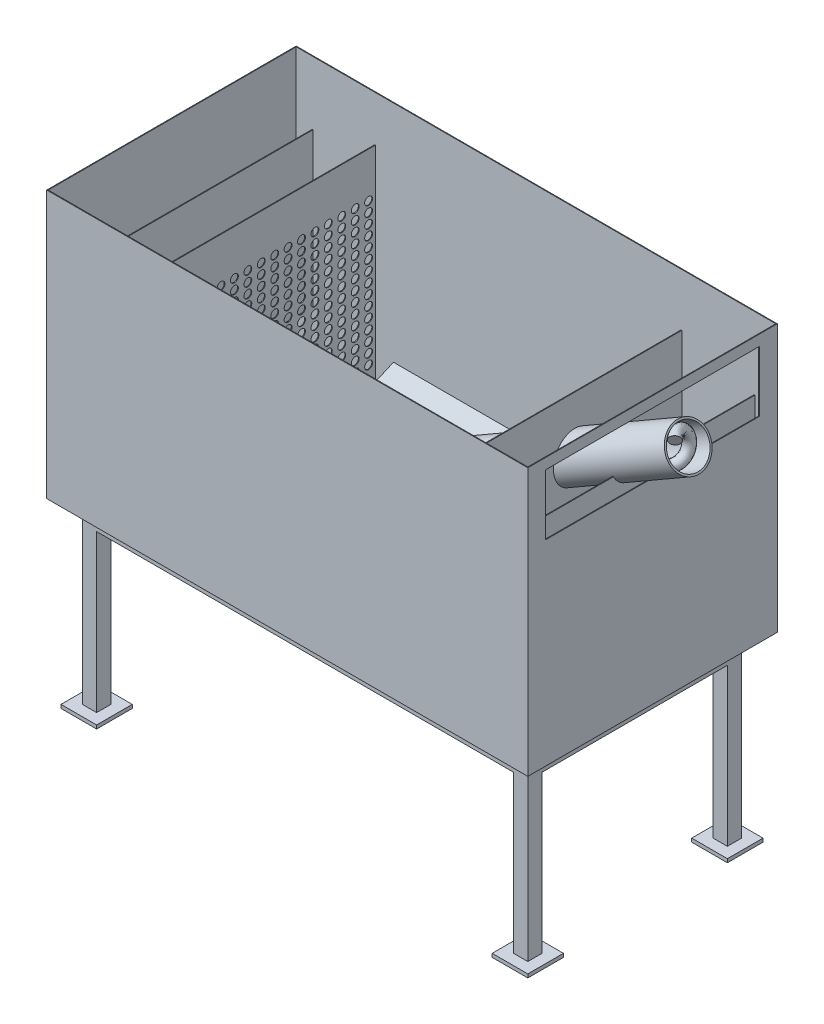
from build123d import *

# Parameters (mm, degrees)
MASTER_FOOTPRINT_W                       = 1350
MASTER_FOOTPRINT_H                       = 700
BATH_BASE_PLATE_DEPTH                    = 750
BATH_SHELL_2MM_T                         = -2
SKETCH_1_R                               = 50.00000000000001
INLET_D100_OPENING_DEPTH                 = 10
INLET_IMPACT_BAFFLE_START                = 125
SKETCH_2_W                               = 540
SKETCH_2_H                               = 430
INLET_IMPACT_BAFFLE_DEPTH                = 2
DISTRIBUTOR_D22_START                    = 250
SKETCH_3_W                               = 639.9999999999999
SKETCH_3_H                               = 648
SKETCH_3_R                               = 11.000000000000004
SKETCH_3_R_2                             = 10.999999999999996
SKETCH_3_R_3                             = 11.00000000000001
DISTRIBUTOR_D22_DEPTH                    = 2
OUTLET_SUBMERGED_BAFFLE_START            = 1130.0000000000002
SKETCH_4_W                               = 599.9999999999999
SKETCH_4_H                               = 330
OUTLET_SUBMERGED_BAFFLE_DEPTH            = 2
OVERFLOW_WEIR_Z550_START                 = 1290
SKETCH_5_W                               = 690
SKETCH_5_H                               = 548
OVERFLOW_WEIR_Z550_DEPTH                 = 2
OUTLET_WEIR_SLOT_W600_START              = 1345.0000000000002
SKETCH_6_W                               = 599.9999999999999
SKETCH_6_H                               = 170
OUTLET_WEIR_SLOT_W600_DEPTH              = 10
SLOPED_SEDIMENT_FLOOR_START              = 275
SLOPED_SEDIMENT_FLOOR_DEPTH              = 825.0000000000001
SKETCH_8_W                               = 39.99999999999999
SKETCH_8_H                               = 39.99999999999999
SKETCH_8_H_2                             = 40
SKETCH_8_W_2                             = 40
FRAME_LEGS_40X40_H500_DEPTH              = 500
FRAME_LONGITUDINAL_RAILS_START           = -20
SKETCH_9_W                               = 1250
SKETCH_9_H                               = 39.99999999999999
SKETCH_9_H_2                             = 39.999999999999886
FRAME_LONGITUDINAL_RAILS_DEPTH           = 40
FRAME_TRANSVERSE_RAILS_START             = -20
SKETCH_10_W                              = 39.99999999999999
SKETCH_10_H                              = 520
SKETCH_10_W_2                            = 40
FRAME_TRANSVERSE_RAILS_DEPTH             = 40
FRAME_FOOT_PADS_100X100_START            = -500
SKETCH_11_W                              = 100.00000000000001
SKETCH_11_H                              = 100.00000000000001
SKETCH_11_H_2                            = 99.99999999999989
SKETCH_11_W_2                            = 100
FRAME_FOOT_PADS_100X100_DEPTH            = 10
SCREW_PASSAGE_D120_PROFILE_R             = 60
SCREW_CASING_ID110_T5_START              = 381.410161514
SCREW_CASING_ID110_T5_OUTLINE_R          = 60
SCREW_CASING_ID110_T5_OUTLINE_R_2        = 55
SCREW_CASING_ID110_T5_DEPTH              = 1212.435565298
SHAFTLESS_ROUND_COIL_D100_P100_PROFILE_R = 15


# Read off the part's stored shape, not the designer's step: SCREW_CASING_ID110_T5
with BuildPart() as part:
    # MASTER_FOOTPRINT → BATH_BASE_PLATE (new body)
    with BuildSketch(Plane(origin=(0, 0, 0), x_dir=(1, 0, 0), z_dir=(0, 1, 0))):
        with Locations((675, 350)):
            Rectangle(MASTER_FOOTPRINT_W, MASTER_FOOTPRINT_H)
    extrude(amount=BATH_BASE_PLATE_DEPTH)

    # BATH_SHELL_2MM
    bath_shell_2mm_openings = [part.faces().sort_by_distance(p)[0] for p in [
        (675, 750, -350),
    ]]
    offset(amount=BATH_SHELL_2MM_T, openings=bath_shell_2mm_openings, kind=Kind.INTERSECTION)

    # Эскиз1 → INLET_D100_OPENING (cut)
    with BuildSketch(Plane(origin=(0, 0, 0), x_dir=(0, 0, -1), z_dir=(1, 0, 0))):
        with Locations((350, 420)):
            Circle(SKETCH_1_R)
    extrude(amount=INLET_D100_OPENING_DEPTH, mode=Mode.SUBTRACT)

    # Эскиз6 → OUTLET_WEIR_SLOT_W600 (cut)
    with BuildSketch(Plane(origin=(0, 0, 0), x_dir=(0, 0, -1), z_dir=(1, 0, 0)).offset(OUTLET_WEIR_SLOT_W600_START)):
        with Locations((349.99999999999994, 635)):
            Rectangle(SKETCH_6_W, SKETCH_6_H)
    extrude(amount=OUTLET_WEIR_SLOT_W600_DEPTH, mode=Mode.SUBTRACT)

    # Эскиз7 → SLOPED_SEDIMENT_FLOOR (add)
    with BuildSketch(Plane(origin=(0, 0, 0), x_dir=(0, 0, -1), z_dir=(1, 0, 0)).offset(SLOPED_SEDIMENT_FLOOR_START)):
        Polygon((2, -1), (2, 120), (279.99999999999994, -1), align=None)
        Polygon((698, -1), (698, 120), (420, -1), align=None)
    extrude(amount=SLOPED_SEDIMENT_FLOOR_DEPTH)

    # Эскиз8 → FRAME_LEGS_40X40_H500 (add)
    with BuildSketch(Plane(origin=(0, 0, 0), x_dir=(1, 0, 0), z_dir=(0, 1, 0))):
        with Locations((70, 70)):
            Rectangle(SKETCH_8_W, SKETCH_8_H)
        with Locations((70, 630)):
            Rectangle(SKETCH_8_W, SKETCH_8_H_2)
        with Locations((1280, 70)):
            Rectangle(SKETCH_8_W_2, SKETCH_8_H)
        with Locations((1280, 630)):
            Rectangle(SKETCH_8_W_2, SKETCH_8_H_2)
    extrude(amount=-FRAME_LEGS_40X40_H500_DEPTH)

    # Эскиз9 → FRAME_LONGITUDINAL_RAILS (add)
    with BuildSketch(Plane(origin=(0, 0, 0), x_dir=(1, 0, 0), z_dir=(0, 1, 0)).offset(FRAME_LONGITUDINAL_RAILS_START)):
        with Locations((675, 70)):
            Rectangle(SKETCH_9_W, SKETCH_9_H)
        with Locations((675, 630)):
            Rectangle(SKETCH_9_W, SKETCH_9_H_2)
    extrude(amount=-FRAME_LONGITUDINAL_RAILS_DEPTH)

    # Эскиз10 → FRAME_TRANSVERSE_RAILS (add)
    with BuildSketch(Plane(origin=(0, 0, 0), x_dir=(1, 0, 0), z_dir=(0, 1, 0)).offset(FRAME_TRANSVERSE_RAILS_START)):
        with Locations((70, 350)):
            Rectangle(SKETCH_10_W, SKETCH_10_H)
        with Locations((1280, 350)):
            Rectangle(SKETCH_10_W_2, SKETCH_10_H)
    extrude(amount=-FRAME_TRANSVERSE_RAILS_DEPTH)

    # Эскиз11 → FRAME_FOOT_PADS_100X100 (add)
    with BuildSketch(Plane(origin=(0, 0, 0), x_dir=(1, 0, 0), z_dir=(0, 1, 0)).offset(FRAME_FOOT_PADS_100X100_START)):
        with Locations((70, 70)):
            Rectangle(SKETCH_11_W, SKETCH_11_H)
        with Locations((70, 630)):
            Rectangle(SKETCH_11_W, SKETCH_11_H_2)
        with Locations((1280, 70)):
            Rectangle(SKETCH_11_W_2, SKETCH_11_H)
        with Locations((1280, 630)):
            Rectangle(SKETCH_11_W_2, SKETCH_11_H_2)
    extrude(amount=-FRAME_FOOT_PADS_100X100_DEPTH)


with BuildPart() as body_2:
    # Эскиз2 → INLET_IMPACT_BAFFLE (new body)
    with BuildSketch(Plane(origin=(0, 0, 0), x_dir=(0, 0, -1), z_dir=(1, 0, 0)).offset(INLET_IMPACT_BAFFLE_START)):
        with Locations((350, 435)):
            Rectangle(SKETCH_2_W, SKETCH_2_H)
    extrude(amount=INLET_IMPACT_BAFFLE_DEPTH)


with BuildPart() as body_3:
    # Эскиз3 → DISTRIBUTOR_D22 (new body)
    with BuildSketch(Plane(origin=(0, 0, 0), x_dir=(0, 0, -1), z_dir=(1, 0, 0)).offset(DISTRIBUTOR_D22_START)):
        with Locations((349.99999999999994, 326)):
            Rectangle(SKETCH_3_W, SKETCH_3_H)
        with Locations((48.8235294117647, 125)):
            Circle(SKETCH_3_R, mode=Mode.SUBTRACT)
        with Locations((48.8235294117647, 153.5)):
            Circle(SKETCH_3_R, mode=Mode.SUBTRACT)
        with Locations((48.8235294117647, 182)):
            Circle(SKETCH_3_R, mode=Mode.SUBTRACT)
        with Locations((48.8235294117647, 210.50000000000003)):
            Circle(SKETCH_3_R, mode=Mode.SUBTRACT)
        with Locations((48.8235294117647, 239)):
            Circle(SKETCH_3_R, mode=Mode.SUBTRACT)
        with Locations((48.8235294117647, 267.5)):
            Circle(SKETCH_3_R, mode=Mode.SUBTRACT)
        with Locations((48.8235294117647, 296.00000000000006)):
            Circle(SKETCH_3_R, mode=Mode.SUBTRACT)
        with Locations((48.8235294117647, 324.5)):
            Circle(SKETCH_3_R, mode=Mode.SUBTRACT)
        with Locations((48.8235294117647, 353)):
            Circle(SKETCH_3_R, mode=Mode.SUBTRACT)
        with Locations((48.8235294117647, 381.5)):
            Circle(SKETCH_3_R, mode=Mode.SUBTRACT)
        with Locations((48.8235294117647, 410.00000000000006)):
            Circle(SKETCH_3_R, mode=Mode.SUBTRACT)
        with Locations((48.8235294117647, 438.5)):
            Circle(SKETCH_3_R, mode=Mode.SUBTRACT)
        with Locations((48.8235294117647, 467)):
            Circle(SKETCH_3_R, mode=Mode.SUBTRACT)
        with Locations((48.8235294117647, 495.5)):
            Circle(SKETCH_3_R, mode=Mode.SUBTRACT)
        with Locations((48.8235294117647, 524)):
            Circle(SKETCH_3_R, mode=Mode.SUBTRACT)
        with Locations((86.4705882352941, 125)):
            Circle(SKETCH_3_R_2, mode=Mode.SUBTRACT)
        with Locations((86.4705882352941, 153.5)):
            Circle(SKETCH_3_R_2, mode=Mode.SUBTRACT)
        with Locations((86.4705882352941, 182)):
            Circle(SKETCH_3_R_2, mode=Mode.SUBTRACT)
        with Locations((86.4705882352941, 210.50000000000003)):
            Circle(SKETCH_3_R_2, mode=Mode.SUBTRACT)
        with Locations((86.4705882352941, 239)):
            Circle(SKETCH_3_R_2, mode=Mode.SUBTRACT)
        with Locations((86.4705882352941, 267.5)):
            Circle(SKETCH_3_R_2, mode=Mode.SUBTRACT)
        with Locations((86.4705882352941, 296.00000000000006)):
            Circle(SKETCH_3_R_2, mode=Mode.SUBTRACT)
        with Locations((86.4705882352941, 324.5)):
            Circle(SKETCH_3_R_2, mode=Mode.SUBTRACT)
        with Locations((86.4705882352941, 353)):
            Circle(SKETCH_3_R_2, mode=Mode.SUBTRACT)
        with Locations((86.4705882352941, 381.5)):
            Circle(SKETCH_3_R_2, mode=Mode.SUBTRACT)
        with Locations((86.4705882352941, 410.00000000000006)):
            Circle(SKETCH_3_R_2, mode=Mode.SUBTRACT)
        with Locations((86.4705882352941, 438.5)):
            Circle(SKETCH_3_R_2, mode=Mode.SUBTRACT)
        with Locations((86.4705882352941, 467)):
            Circle(SKETCH_3_R_2, mode=Mode.SUBTRACT)
        with Locations((86.4705882352941, 495.5)):
            Circle(SKETCH_3_R_2, mode=Mode.SUBTRACT)
        with Locations((86.4705882352941, 524)):
            Circle(SKETCH_3_R_2, mode=Mode.SUBTRACT)
        with Locations((124.11764705882351, 125)):
            Circle(SKETCH_3_R_2, mode=Mode.SUBTRACT)
        with Locations((124.11764705882351, 153.5)):
            Circle(SKETCH_3_R_2, mode=Mode.SUBTRACT)
        with Locations((124.11764705882351, 182)):
            Circle(SKETCH_3_R_2, mode=Mode.SUBTRACT)
        with Locations((124.11764705882351, 210.50000000000003)):
            Circle(SKETCH_3_R_2, mode=Mode.SUBTRACT)
        with Locations((124.11764705882351, 239)):
            Circle(SKETCH_3_R_2, mode=Mode.SUBTRACT)
        with Locations((124.11764705882351, 267.5)):
            Circle(SKETCH_3_R_2, mode=Mode.SUBTRACT)
        with Locations((124.11764705882351, 296.00000000000006)):
            Circle(SKETCH_3_R_2, mode=Mode.SUBTRACT)
        with Locations((124.11764705882351, 324.5)):
            Circle(SKETCH_3_R_2, mode=Mode.SUBTRACT)
        with Locations((124.11764705882351, 353)):
            Circle(SKETCH_3_R_2, mode=Mode.SUBTRACT)
        with Locations((124.11764705882351, 381.5)):
            Circle(SKETCH_3_R_2, mode=Mode.SUBTRACT)
        with Locations((124.11764705882351, 410.00000000000006)):
            Circle(SKETCH_3_R_2, mode=Mode.SUBTRACT)
        with Locations((124.11764705882351, 438.5)):
            Circle(SKETCH_3_R_2, mode=Mode.SUBTRACT)
        with Locations((124.11764705882351, 467)):
            Circle(SKETCH_3_R_2, mode=Mode.SUBTRACT)
        with Locations((124.11764705882351, 495.5)):
            Circle(SKETCH_3_R_2, mode=Mode.SUBTRACT)
        with Locations((124.11764705882351, 524)):
            Circle(SKETCH_3_R_2, mode=Mode.SUBTRACT)
        with Locations((161.76470588235293, 125)):
            Circle(SKETCH_3_R_3, mode=Mode.SUBTRACT)
        with Locations((161.76470588235293, 153.5)):
            Circle(SKETCH_3_R_3, mode=Mode.SUBTRACT)
        with Locations((161.76470588235293, 182)):
            Circle(SKETCH_3_R_3, mode=Mode.SUBTRACT)
        with Locations((161.76470588235293, 210.50000000000003)):
            Circle(SKETCH_3_R_3, mode=Mode.SUBTRACT)
        with Locations((161.76470588235293, 239)):
            Circle(SKETCH_3_R_3, mode=Mode.SUBTRACT)
        with Locations((161.76470588235293, 267.5)):
            Circle(SKETCH_3_R_3, mode=Mode.SUBTRACT)
        with Locations((161.76470588235293, 296.00000000000006)):
            Circle(SKETCH_3_R_3, mode=Mode.SUBTRACT)
        with Locations((161.76470588235293, 324.5)):
            Circle(SKETCH_3_R_3, mode=Mode.SUBTRACT)
        with Locations((161.76470588235293, 353)):
            Circle(SKETCH_3_R_3, mode=Mode.SUBTRACT)
        with Locations((161.76470588235293, 381.5)):
            Circle(SKETCH_3_R_3, mode=Mode.SUBTRACT)
        with Locations((161.76470588235293, 410.00000000000006)):
            Circle(SKETCH_3_R_3, mode=Mode.SUBTRACT)
        with Locations((161.76470588235293, 438.5)):
            Circle(SKETCH_3_R_3, mode=Mode.SUBTRACT)
        with Locations((161.76470588235293, 467)):
            Circle(SKETCH_3_R_3, mode=Mode.SUBTRACT)
        with Locations((161.76470588235293, 495.5)):
            Circle(SKETCH_3_R_3, mode=Mode.SUBTRACT)
        with Locations((161.76470588235293, 524)):
            Circle(SKETCH_3_R_3, mode=Mode.SUBTRACT)
        with Locations((199.41176470588232, 125)):
            Circle(SKETCH_3_R_3, mode=Mode.SUBTRACT)
        with Locations((199.41176470588232, 153.5)):
            Circle(SKETCH_3_R_3, mode=Mode.SUBTRACT)
        with Locations((199.41176470588232, 182)):
            Circle(SKETCH_3_R_3, mode=Mode.SUBTRACT)
        with Locations((199.41176470588232, 210.50000000000003)):
            Circle(SKETCH_3_R_3, mode=Mode.SUBTRACT)
        with Locations((199.41176470588232, 239)):
            Circle(SKETCH_3_R_3, mode=Mode.SUBTRACT)
        with Locations((199.41176470588232, 267.5)):
            Circle(SKETCH_3_R_3, mode=Mode.SUBTRACT)
        with Locations((199.41176470588232, 296.00000000000006)):
            Circle(SKETCH_3_R_3, mode=Mode.SUBTRACT)
        with Locations((199.41176470588232, 324.5)):
            Circle(SKETCH_3_R_3, mode=Mode.SUBTRACT)
        with Locations((199.41176470588232, 353)):
            Circle(SKETCH_3_R_3, mode=Mode.SUBTRACT)
        with Locations((199.41176470588232, 381.5)):
            Circle(SKETCH_3_R_3, mode=Mode.SUBTRACT)
        with Locations((199.41176470588232, 410.00000000000006)):
            Circle(SKETCH_3_R_3, mode=Mode.SUBTRACT)
        with Locations((199.41176470588232, 438.5)):
            Circle(SKETCH_3_R_3, mode=Mode.SUBTRACT)
        with Locations((199.41176470588232, 467)):
            Circle(SKETCH_3_R_3, mode=Mode.SUBTRACT)
        with Locations((199.41176470588232, 495.5)):
            Circle(SKETCH_3_R_3, mode=Mode.SUBTRACT)
        with Locations((199.41176470588232, 524)):
            Circle(SKETCH_3_R_3, mode=Mode.SUBTRACT)
        with Locations((237.05882352941174, 125)):
            Circle(SKETCH_3_R_3, mode=Mode.SUBTRACT)
        with Locations((237.05882352941174, 153.5)):
            Circle(SKETCH_3_R_3, mode=Mode.SUBTRACT)
        with Locations((237.05882352941174, 182)):
            Circle(SKETCH_3_R_3, mode=Mode.SUBTRACT)
        with Locations((237.05882352941174, 210.50000000000003)):
            Circle(SKETCH_3_R_3, mode=Mode.SUBTRACT)
        with Locations((237.05882352941174, 239)):
            Circle(SKETCH_3_R_3, mode=Mode.SUBTRACT)
        with Locations((237.05882352941174, 267.5)):
            Circle(SKETCH_3_R_3, mode=Mode.SUBTRACT)
        with Locations((237.05882352941174, 296.00000000000006)):
            Circle(SKETCH_3_R_3, mode=Mode.SUBTRACT)
        with Locations((237.05882352941174, 324.5)):
            Circle(SKETCH_3_R_3, mode=Mode.SUBTRACT)
        with Locations((237.05882352941174, 353)):
            Circle(SKETCH_3_R_3, mode=Mode.SUBTRACT)
        with Locations((237.05882352941174, 381.5)):
            Circle(SKETCH_3_R_3, mode=Mode.SUBTRACT)
        with Locations((237.05882352941174, 410.00000000000006)):
            Circle(SKETCH_3_R_3, mode=Mode.SUBTRACT)
        with Locations((237.05882352941174, 438.5)):
            Circle(SKETCH_3_R_3, mode=Mode.SUBTRACT)
        with Locations((237.05882352941174, 467)):
            Circle(SKETCH_3_R_3, mode=Mode.SUBTRACT)
        with Locations((237.05882352941174, 495.5)):
            Circle(SKETCH_3_R_3, mode=Mode.SUBTRACT)
        with Locations((237.05882352941174, 524)):
            Circle(SKETCH_3_R_3, mode=Mode.SUBTRACT)
        with Locations((274.70588235294116, 125)):
            Circle(SKETCH_3_R_3, mode=Mode.SUBTRACT)
        with Locations((274.70588235294116, 153.5)):
            Circle(SKETCH_3_R_3, mode=Mode.SUBTRACT)
        with Locations((274.70588235294116, 182)):
            Circle(SKETCH_3_R_3, mode=Mode.SUBTRACT)
        with Locations((274.70588235294116, 210.50000000000003)):
            Circle(SKETCH_3_R_3, mode=Mode.SUBTRACT)
        with Locations((274.70588235294116, 239)):
            Circle(SKETCH_3_R_3, mode=Mode.SUBTRACT)
        with Locations((274.70588235294116, 267.5)):
            Circle(SKETCH_3_R_3, mode=Mode.SUBTRACT)
        with Locations((274.70588235294116, 296.00000000000006)):
            Circle(SKETCH_3_R_3, mode=Mode.SUBTRACT)
        with Locations((274.70588235294116, 324.5)):
            Circle(SKETCH_3_R_3, mode=Mode.SUBTRACT)
        with Locations((274.70588235294116, 353)):
            Circle(SKETCH_3_R_3, mode=Mode.SUBTRACT)
        with Locations((274.70588235294116, 381.5)):
            Circle(SKETCH_3_R_3, mode=Mode.SUBTRACT)
        with Locations((274.70588235294116, 410.00000000000006)):
            Circle(SKETCH_3_R_3, mode=Mode.SUBTRACT)
        with Locations((274.70588235294116, 438.5)):
            Circle(SKETCH_3_R_3, mode=Mode.SUBTRACT)
        with Locations((274.70588235294116, 467)):
            Circle(SKETCH_3_R_3, mode=Mode.SUBTRACT)
        with Locations((274.70588235294116, 495.5)):
            Circle(SKETCH_3_R_3, mode=Mode.SUBTRACT)
        with Locations((274.70588235294116, 524)):
            Circle(SKETCH_3_R_3, mode=Mode.SUBTRACT)
        with Locations((312.3529411764705, 125)):
            Circle(SKETCH_3_R_3, mode=Mode.SUBTRACT)
        with Locations((312.3529411764705, 153.5)):
            Circle(SKETCH_3_R_3, mode=Mode.SUBTRACT)
        with Locations((312.3529411764705, 182)):
            Circle(SKETCH_3_R_3, mode=Mode.SUBTRACT)
        with Locations((312.3529411764705, 210.50000000000003)):
            Circle(SKETCH_3_R_3, mode=Mode.SUBTRACT)
        with Locations((312.3529411764705, 239)):
            Circle(SKETCH_3_R_3, mode=Mode.SUBTRACT)
        with Locations((312.3529411764705, 267.5)):
            Circle(SKETCH_3_R_3, mode=Mode.SUBTRACT)
        with Locations((312.3529411764705, 296.00000000000006)):
            Circle(SKETCH_3_R_3, mode=Mode.SUBTRACT)
        with Locations((312.3529411764705, 324.5)):
            Circle(SKETCH_3_R_3, mode=Mode.SUBTRACT)
        with Locations((312.3529411764705, 353)):
            Circle(SKETCH_3_R_3, mode=Mode.SUBTRACT)
        with Locations((312.3529411764705, 381.5)):
            Circle(SKETCH_3_R_3, mode=Mode.SUBTRACT)
        with Locations((312.3529411764705, 410.00000000000006)):
            Circle(SKETCH_3_R_3, mode=Mode.SUBTRACT)
        with Locations((312.3529411764705, 438.5)):
            Circle(SKETCH_3_R_3, mode=Mode.SUBTRACT)
        with Locations((312.3529411764705, 467)):
            Circle(SKETCH_3_R_3, mode=Mode.SUBTRACT)
        with Locations((312.3529411764705, 495.5)):
            Circle(SKETCH_3_R_3, mode=Mode.SUBTRACT)
        with Locations((312.3529411764705, 524)):
            Circle(SKETCH_3_R_3, mode=Mode.SUBTRACT)
        with Locations((350, 125)):
            Circle(SKETCH_3_R_3, mode=Mode.SUBTRACT)
        with Locations((350, 153.5)):
            Circle(SKETCH_3_R_3, mode=Mode.SUBTRACT)
        with Locations((350, 182)):
            Circle(SKETCH_3_R_3, mode=Mode.SUBTRACT)
        with Locations((350, 210.50000000000003)):
            Circle(SKETCH_3_R_3, mode=Mode.SUBTRACT)
        with Locations((350, 239)):
            Circle(SKETCH_3_R_3, mode=Mode.SUBTRACT)
        with Locations((350, 267.5)):
            Circle(SKETCH_3_R_3, mode=Mode.SUBTRACT)
        with Locations((350, 296.00000000000006)):
            Circle(SKETCH_3_R_3, mode=Mode.SUBTRACT)
        with Locations((350, 324.5)):
            Circle(SKETCH_3_R_3, mode=Mode.SUBTRACT)
        with Locations((350, 353)):
            Circle(SKETCH_3_R_3, mode=Mode.SUBTRACT)
        with Locations((350, 381.5)):
            Circle(SKETCH_3_R_3, mode=Mode.SUBTRACT)
        with Locations((350, 410.00000000000006)):
            Circle(SKETCH_3_R_3, mode=Mode.SUBTRACT)
        with Locations((350, 438.5)):
            Circle(SKETCH_3_R_3, mode=Mode.SUBTRACT)
        with Locations((350, 467)):
            Circle(SKETCH_3_R_3, mode=Mode.SUBTRACT)
        with Locations((350, 495.5)):
            Circle(SKETCH_3_R_3, mode=Mode.SUBTRACT)
        with Locations((350, 524)):
            Circle(SKETCH_3_R_3, mode=Mode.SUBTRACT)
        with Locations((387.64705882352933, 125)):
            Circle(SKETCH_3_R_3, mode=Mode.SUBTRACT)
        with Locations((387.64705882352933, 153.5)):
            Circle(SKETCH_3_R_3, mode=Mode.SUBTRACT)
        with Locations((387.64705882352933, 182)):
            Circle(SKETCH_3_R_3, mode=Mode.SUBTRACT)
        with Locations((387.64705882352933, 210.50000000000003)):
            Circle(SKETCH_3_R_3, mode=Mode.SUBTRACT)
        with Locations((387.64705882352933, 239)):
            Circle(SKETCH_3_R_3, mode=Mode.SUBTRACT)
        with Locations((387.64705882352933, 267.5)):
            Circle(SKETCH_3_R_3, mode=Mode.SUBTRACT)
        with Locations((387.64705882352933, 296.00000000000006)):
            Circle(SKETCH_3_R_3, mode=Mode.SUBTRACT)
        with Locations((387.64705882352933, 324.5)):
            Circle(SKETCH_3_R_3, mode=Mode.SUBTRACT)
        with Locations((387.64705882352933, 353)):
            Circle(SKETCH_3_R_3, mode=Mode.SUBTRACT)
        with Locations((387.64705882352933, 381.5)):
            Circle(SKETCH_3_R_3, mode=Mode.SUBTRACT)
        with Locations((387.64705882352933, 410.00000000000006)):
            Circle(SKETCH_3_R_3, mode=Mode.SUBTRACT)
        with Locations((387.64705882352933, 438.5)):
            Circle(SKETCH_3_R_3, mode=Mode.SUBTRACT)
        with Locations((387.64705882352933, 467)):
            Circle(SKETCH_3_R_3, mode=Mode.SUBTRACT)
        with Locations((387.64705882352933, 495.5)):
            Circle(SKETCH_3_R_3, mode=Mode.SUBTRACT)
        with Locations((387.64705882352933, 524)):
            Circle(SKETCH_3_R_3, mode=Mode.SUBTRACT)
        with Locations((425.2941176470587, 125)):
            Circle(SKETCH_3_R_3, mode=Mode.SUBTRACT)
        with Locations((425.2941176470587, 153.5)):
            Circle(SKETCH_3_R_3, mode=Mode.SUBTRACT)
        with Locations((425.2941176470587, 182)):
            Circle(SKETCH_3_R_3, mode=Mode.SUBTRACT)
        with Locations((425.2941176470587, 210.50000000000003)):
            Circle(SKETCH_3_R_3, mode=Mode.SUBTRACT)
        with Locations((425.2941176470587, 239)):
            Circle(SKETCH_3_R_3, mode=Mode.SUBTRACT)
        with Locations((425.2941176470587, 267.5)):
            Circle(SKETCH_3_R_3, mode=Mode.SUBTRACT)
        with Locations((425.2941176470587, 296.00000000000006)):
            Circle(SKETCH_3_R_3, mode=Mode.SUBTRACT)
        with Locations((425.2941176470587, 324.5)):
            Circle(SKETCH_3_R_3, mode=Mode.SUBTRACT)
        with Locations((425.2941176470587, 353)):
            Circle(SKETCH_3_R_3, mode=Mode.SUBTRACT)
        with Locations((425.2941176470587, 381.5)):
            Circle(SKETCH_3_R_3, mode=Mode.SUBTRACT)
        with Locations((425.2941176470587, 410.00000000000006)):
            Circle(SKETCH_3_R_3, mode=Mode.SUBTRACT)
        with Locations((425.2941176470587, 438.5)):
            Circle(SKETCH_3_R_3, mode=Mode.SUBTRACT)
        with Locations((425.2941176470587, 467)):
            Circle(SKETCH_3_R_3, mode=Mode.SUBTRACT)
        with Locations((425.2941176470587, 495.5)):
            Circle(SKETCH_3_R_3, mode=Mode.SUBTRACT)
        with Locations((425.2941176470587, 524)):
            Circle(SKETCH_3_R_3, mode=Mode.SUBTRACT)
        with Locations((462.9411764705882, 125)):
            Circle(SKETCH_3_R_3, mode=Mode.SUBTRACT)
        with Locations((462.9411764705882, 153.5)):
            Circle(SKETCH_3_R_3, mode=Mode.SUBTRACT)
        with Locations((462.9411764705882, 182)):
            Circle(SKETCH_3_R_3, mode=Mode.SUBTRACT)
        with Locations((462.9411764705882, 210.50000000000003)):
            Circle(SKETCH_3_R_3, mode=Mode.SUBTRACT)
        with Locations((462.9411764705882, 239)):
            Circle(SKETCH_3_R_3, mode=Mode.SUBTRACT)
        with Locations((462.9411764705882, 267.5)):
            Circle(SKETCH_3_R_3, mode=Mode.SUBTRACT)
        with Locations((462.9411764705882, 296.00000000000006)):
            Circle(SKETCH_3_R_3, mode=Mode.SUBTRACT)
        with Locations((462.9411764705882, 324.5)):
            Circle(SKETCH_3_R_3, mode=Mode.SUBTRACT)
        with Locations((462.9411764705882, 353)):
            Circle(SKETCH_3_R_3, mode=Mode.SUBTRACT)
        with Locations((462.9411764705882, 381.5)):
            Circle(SKETCH_3_R_3, mode=Mode.SUBTRACT)
        with Locations((462.9411764705882, 410.00000000000006)):
            Circle(SKETCH_3_R_3, mode=Mode.SUBTRACT)
        with Locations((462.9411764705882, 438.5)):
            Circle(SKETCH_3_R_3, mode=Mode.SUBTRACT)
        with Locations((462.9411764705882, 467)):
            Circle(SKETCH_3_R_3, mode=Mode.SUBTRACT)
        with Locations((462.9411764705882, 495.5)):
            Circle(SKETCH_3_R_3, mode=Mode.SUBTRACT)
        with Locations((462.9411764705882, 524)):
            Circle(SKETCH_3_R_3, mode=Mode.SUBTRACT)
        with Locations((500.58823529411757, 125)):
            Circle(SKETCH_3_R_3, mode=Mode.SUBTRACT)
        with Locations((500.58823529411757, 153.5)):
            Circle(SKETCH_3_R_3, mode=Mode.SUBTRACT)
        with Locations((500.58823529411757, 182)):
            Circle(SKETCH_3_R_3, mode=Mode.SUBTRACT)
        with Locations((500.58823529411757, 210.50000000000003)):
            Circle(SKETCH_3_R_3, mode=Mode.SUBTRACT)
        with Locations((500.58823529411757, 239)):
            Circle(SKETCH_3_R_3, mode=Mode.SUBTRACT)
        with Locations((500.58823529411757, 267.5)):
            Circle(SKETCH_3_R_3, mode=Mode.SUBTRACT)
        with Locations((500.58823529411757, 296.00000000000006)):
            Circle(SKETCH_3_R_3, mode=Mode.SUBTRACT)
        with Locations((500.58823529411757, 324.5)):
            Circle(SKETCH_3_R_3, mode=Mode.SUBTRACT)
        with Locations((500.58823529411757, 353)):
            Circle(SKETCH_3_R_3, mode=Mode.SUBTRACT)
        with Locations((500.58823529411757, 381.5)):
            Circle(SKETCH_3_R_3, mode=Mode.SUBTRACT)
        with Locations((500.58823529411757, 410.00000000000006)):
            Circle(SKETCH_3_R_3, mode=Mode.SUBTRACT)
        with Locations((500.58823529411757, 438.5)):
            Circle(SKETCH_3_R_3, mode=Mode.SUBTRACT)
        with Locations((500.58823529411757, 467)):
            Circle(SKETCH_3_R_3, mode=Mode.SUBTRACT)
        with Locations((500.58823529411757, 495.5)):
            Circle(SKETCH_3_R_3, mode=Mode.SUBTRACT)
        with Locations((500.58823529411757, 524)):
            Circle(SKETCH_3_R_3, mode=Mode.SUBTRACT)
        with Locations((538.2352941176471, 125)):
            Circle(SKETCH_3_R_3, mode=Mode.SUBTRACT)
        with Locations((538.2352941176471, 153.5)):
            Circle(SKETCH_3_R_3, mode=Mode.SUBTRACT)
        with Locations((538.2352941176471, 182)):
            Circle(SKETCH_3_R_3, mode=Mode.SUBTRACT)
        with Locations((538.2352941176471, 210.50000000000003)):
            Circle(SKETCH_3_R_3, mode=Mode.SUBTRACT)
        with Locations((538.2352941176471, 239)):
            Circle(SKETCH_3_R_3, mode=Mode.SUBTRACT)
        with Locations((538.2352941176471, 267.5)):
            Circle(SKETCH_3_R_3, mode=Mode.SUBTRACT)
        with Locations((538.2352941176471, 296.00000000000006)):
            Circle(SKETCH_3_R_3, mode=Mode.SUBTRACT)
        with Locations((538.2352941176471, 324.5)):
            Circle(SKETCH_3_R_3, mode=Mode.SUBTRACT)
        with Locations((538.2352941176471, 353)):
            Circle(SKETCH_3_R_3, mode=Mode.SUBTRACT)
        with Locations((538.2352941176471, 381.5)):
            Circle(SKETCH_3_R_3, mode=Mode.SUBTRACT)
        with Locations((538.2352941176471, 410.00000000000006)):
            Circle(SKETCH_3_R_3, mode=Mode.SUBTRACT)
        with Locations((538.2352941176471, 438.5)):
            Circle(SKETCH_3_R_3, mode=Mode.SUBTRACT)
        with Locations((538.2352941176471, 467)):
            Circle(SKETCH_3_R_3, mode=Mode.SUBTRACT)
        with Locations((538.2352941176471, 495.5)):
            Circle(SKETCH_3_R_3, mode=Mode.SUBTRACT)
        with Locations((538.2352941176471, 524)):
            Circle(SKETCH_3_R_3, mode=Mode.SUBTRACT)
        with Locations((575.8823529411765, 125)):
            Circle(SKETCH_3_R_3, mode=Mode.SUBTRACT)
        with Locations((575.8823529411765, 153.5)):
            Circle(SKETCH_3_R_3, mode=Mode.SUBTRACT)
        with Locations((575.8823529411765, 182)):
            Circle(SKETCH_3_R_3, mode=Mode.SUBTRACT)
        with Locations((575.8823529411765, 210.50000000000003)):
            Circle(SKETCH_3_R_3, mode=Mode.SUBTRACT)
        with Locations((575.8823529411765, 239)):
            Circle(SKETCH_3_R_3, mode=Mode.SUBTRACT)
        with Locations((575.8823529411765, 267.5)):
            Circle(SKETCH_3_R_3, mode=Mode.SUBTRACT)
        with Locations((575.8823529411765, 296.00000000000006)):
            Circle(SKETCH_3_R_3, mode=Mode.SUBTRACT)
        with Locations((575.8823529411765, 324.5)):
            Circle(SKETCH_3_R_3, mode=Mode.SUBTRACT)
        with Locations((575.8823529411765, 353)):
            Circle(SKETCH_3_R_3, mode=Mode.SUBTRACT)
        with Locations((575.8823529411765, 381.5)):
            Circle(SKETCH_3_R_3, mode=Mode.SUBTRACT)
        with Locations((575.8823529411765, 410.00000000000006)):
            Circle(SKETCH_3_R_3, mode=Mode.SUBTRACT)
        with Locations((575.8823529411765, 438.5)):
            Circle(SKETCH_3_R_3, mode=Mode.SUBTRACT)
        with Locations((575.8823529411765, 467)):
            Circle(SKETCH_3_R_3, mode=Mode.SUBTRACT)
        with Locations((575.8823529411765, 495.5)):
            Circle(SKETCH_3_R_3, mode=Mode.SUBTRACT)
        with Locations((575.8823529411765, 524)):
            Circle(SKETCH_3_R_3, mode=Mode.SUBTRACT)
        with Locations((613.5294117647057, 125)):
            Circle(SKETCH_3_R_3, mode=Mode.SUBTRACT)
        with Locations((613.5294117647057, 153.5)):
            Circle(SKETCH_3_R_3, mode=Mode.SUBTRACT)
        with Locations((613.5294117647057, 182)):
            Circle(SKETCH_3_R_3, mode=Mode.SUBTRACT)
        with Locations((613.5294117647057, 210.50000000000003)):
            Circle(SKETCH_3_R_3, mode=Mode.SUBTRACT)
        with Locations((613.5294117647057, 239)):
            Circle(SKETCH_3_R_3, mode=Mode.SUBTRACT)
        with Locations((613.5294117647057, 267.5)):
            Circle(SKETCH_3_R_3, mode=Mode.SUBTRACT)
        with Locations((613.5294117647057, 296.00000000000006)):
            Circle(SKETCH_3_R_3, mode=Mode.SUBTRACT)
        with Locations((613.5294117647057, 324.5)):
            Circle(SKETCH_3_R_3, mode=Mode.SUBTRACT)
        with Locations((613.5294117647057, 353)):
            Circle(SKETCH_3_R_3, mode=Mode.SUBTRACT)
        with Locations((613.5294117647057, 381.5)):
            Circle(SKETCH_3_R_3, mode=Mode.SUBTRACT)
        with Locations((613.5294117647057, 410.00000000000006)):
            Circle(SKETCH_3_R_3, mode=Mode.SUBTRACT)
        with Locations((613.5294117647057, 438.5)):
            Circle(SKETCH_3_R_3, mode=Mode.SUBTRACT)
        with Locations((613.5294117647057, 467)):
            Circle(SKETCH_3_R_3, mode=Mode.SUBTRACT)
        with Locations((613.5294117647057, 495.5)):
            Circle(SKETCH_3_R_3, mode=Mode.SUBTRACT)
        with Locations((613.5294117647057, 524)):
            Circle(SKETCH_3_R_3, mode=Mode.SUBTRACT)
        with Locations((651.1764705882352, 125)):
            Circle(SKETCH_3_R_3, mode=Mode.SUBTRACT)
        with Locations((651.1764705882352, 153.5)):
            Circle(SKETCH_3_R_3, mode=Mode.SUBTRACT)
        with Locations((651.1764705882352, 182)):
            Circle(SKETCH_3_R_3, mode=Mode.SUBTRACT)
        with Locations((651.1764705882352, 210.50000000000003)):
            Circle(SKETCH_3_R_3, mode=Mode.SUBTRACT)
        with Locations((651.1764705882352, 239)):
            Circle(SKETCH_3_R_3, mode=Mode.SUBTRACT)
        with Locations((651.1764705882352, 267.5)):
            Circle(SKETCH_3_R_3, mode=Mode.SUBTRACT)
        with Locations((651.1764705882352, 296.00000000000006)):
            Circle(SKETCH_3_R_3, mode=Mode.SUBTRACT)
        with Locations((651.1764705882352, 324.5)):
            Circle(SKETCH_3_R_3, mode=Mode.SUBTRACT)
        with Locations((651.1764705882352, 353)):
            Circle(SKETCH_3_R_3, mode=Mode.SUBTRACT)
        with Locations((651.1764705882352, 381.5)):
            Circle(SKETCH_3_R_3, mode=Mode.SUBTRACT)
        with Locations((651.1764705882352, 410.00000000000006)):
            Circle(SKETCH_3_R_3, mode=Mode.SUBTRACT)
        with Locations((651.1764705882352, 438.5)):
            Circle(SKETCH_3_R_3, mode=Mode.SUBTRACT)
        with Locations((651.1764705882352, 467)):
            Circle(SKETCH_3_R_3, mode=Mode.SUBTRACT)
        with Locations((651.1764705882352, 495.5)):
            Circle(SKETCH_3_R_3, mode=Mode.SUBTRACT)
        with Locations((651.1764705882352, 524)):
            Circle(SKETCH_3_R_3, mode=Mode.SUBTRACT)
    extrude(amount=DISTRIBUTOR_D22_DEPTH)


with BuildPart() as body_4:
    # Эскиз4 → OUTLET_SUBMERGED_BAFFLE (new body)
    with BuildSketch(Plane(origin=(0, 0, 0), x_dir=(0, 0, -1), z_dir=(1, 0, 0)).offset(OUTLET_SUBMERGED_BAFFLE_START)):
        with Locations((349.99999999999994, 485)):
            Rectangle(SKETCH_4_W, SKETCH_4_H)
    extrude(amount=OUTLET_SUBMERGED_BAFFLE_DEPTH)


with BuildPart() as body_5:
    # Эскиз5 → OVERFLOW_WEIR_Z550 (new body)
    with BuildSketch(Plane(origin=(0, 0, 0), x_dir=(0, 0, -1), z_dir=(1, 0, 0)).offset(OVERFLOW_WEIR_Z550_START)):
        with Locations((350, 276)):
            Rectangle(SKETCH_5_W, SKETCH_5_H)
    extrude(amount=OVERFLOW_WEIR_Z550_DEPTH)


with BuildPart() as screw_passage_d120_tool:
    # SCREW_PASSAGE_D120: sweep along a curve in space
    with BuildLine() as screw_passage_d120_path:
        Line((400, 70, -350), (1450.0000000000002, 676.2177826491071, -350))
    # SCREW_PASSAGE_D120 profile (on start of the path) → SCREW_PASSAGE_D120 (sweep)
    with BuildSketch(Plane(origin=(400, 70, -350), x_dir=(-0.5, 0.8660254037844387, 0), z_dir=(0.8660254037844387, 0.5, 0))):
        Circle(SCREW_PASSAGE_D120_PROFILE_R)
    sweep(path=screw_passage_d120_path.line)


with BuildPart() as part_1:
    add(part.part)

    # SCREW_PASSAGE_D120: cut by screw_passage_d120_tool
    add(screw_passage_d120_tool.part, mode=Mode.SUBTRACT)


with BuildPart() as body_4_1:
    add(body_4.part)

    # SCREW_PASSAGE_D120: cut by screw_passage_d120_tool
    add(screw_passage_d120_tool.part, mode=Mode.SUBTRACT)


with BuildPart() as body_5_1:
    add(body_5.part)

    # SCREW_PASSAGE_D120: cut by screw_passage_d120_tool
    add(screw_passage_d120_tool.part, mode=Mode.SUBTRACT)


with BuildPart() as body_6:
    # SCREW_CASING_ID110_T5 outline → SCREW_CASING_ID110_T5 (new body)
    with BuildSketch(Plane(origin=(0, 0, 0), x_dir=(0.49999999999999956, -0.8660254037844389, 0), z_dir=(0.8660254037844388, 0.4999999999999999, 0)).offset(SCREW_CASING_ID110_T5_START)):
        with Locations((139.378221735, 350)):
            Circle(SCREW_CASING_ID110_T5_OUTLINE_R)
        with Locations((139.378221735, 350)):
            Circle(SCREW_CASING_ID110_T5_OUTLINE_R_2, mode=Mode.SUBTRACT)
    extrude(amount=SCREW_CASING_ID110_T5_DEPTH)


with BuildPart() as body_7:
    # SHAFTLESS_ROUND_COIL_D100_P100: sweep along a curve in space
    with BuildLine() as shaftless_round_coil_d100_p100_path:
        add(Edge.make_bspline(
            [(382.5, 100.31088913245537, -350), (384.567133941715, 100.8969533609294, -345.41937053476397), (388.701401825145, 102.06908181787745, -336.25811160429197), (398.1604300649253, 98.18490004107339, -324.60808166218715), (409.3560207013292, 91.29290396280325, -316.8233355514321), (421.65033393475863, 82.4978645230609, -314.08890596127725), (433.9307858703661, 73.72683355540538, -316.8210413351117), (445.1692946376928, 66.76050109381076, -324.60384246654075), (454.4743112597251, 63.143075263901785, -336.25257274072055), (461.25452800851986, 63.89873109338379, -349.9940046218062), (465.3013896758794, 69.38869679903786, -363.73634914911577), (466.82285064220457, 79.25278482835391, -375.38767843443037), (466.41118051505055, 92.4651541292667, -383.1743693075307), (464.9529502042635, 107.49021884141047, -385.9110930377908), (463.49403503443136, 122.51646976421685, -383.18125195642824), (463.080416772081, 135.7322133342697, -375.40039602125114), (464.59895631397717, 145.6013614191271, -363.75296573967546), (468.64239206366375, 151.09726098825328, -350.01199075622054), (475.4191101505716, 151.85897667788203, -336.26919048034273), (484.72142291256205, 148.24623407094234, -324.6165621765701), (495.9571841283184, 141.28466050826435, -316.82792675815875), (508.2399284578545, 132.5096589978527, -314.08890896407274), (520.5238135951332, 123.73268155046961, -316.81645567687616), (531.7628235747587, 116.76548096370868, -324.59536619892936), (541.0699985136101, 113.14431681941007, -336.2414961632577), (547.852452046318, 113.89609842550927, -349.98201386608685), (551.901623430333, 119.38206358456459, -363.72526950748664), (553.4250256972631, 129.24278918260035, -375.3791965049296), (553.0146569892961, 142.4529043593589, -383.169776251563), (551.5568836638685, 157.4771775496427, -385.9110880331315), (550.0975132076316, 172.50421705163342, -383.18583576491125), (549.6825962304166, 185.7222100618165, -375.40887087279947), (551.1991914497776, 195.59472581209116, -363.764041550325), (555.2403332104677, 201.0945986867113, -350.02398151110447), (562.0147568532083, 201.86028847021265, -336.28027088724104), (571.3151239851546, 198.25091579336188, -324.6250455209524), (582.5495845590909, 191.29159500839876, -316.83252166323945), (594.8318712250125, 182.51738619462066, -314.0889159705959), (607.1162113447549, 173.73962069449377, -316.81187371827355), (618.3565196932212, 166.77017126693332, -324.5868927636805), (627.6656387431455, 163.14563982348125, -336.2304211197302), (634.4503861869202, 163.8934482590639, -349.9700231123729), (638.5018520914703, 169.3754391919744, -363.7141883356277), (640.0272002050982, 179.23279448466508, -375.3707117459023), (639.6181324635514, 192.44065632148553, -383.1651794974973), (638.1608171847, 207.46413615182624, -385.9110790247452), (636.7009921290735, 222.4919630430578, -383.1904158735057), (636.2847771078771, 235.71220433136685, -375.4173428915129), (637.7994284333626, 245.58808700459835, -363.7751158264218), (641.8382763594567, 251.0919329172832, -350.03597226331453), (648.610405405767, 251.86159705838446, -336.29135282375216), (657.9088264743058, 248.25559506222993, -324.6335316943881), (669.1419857572878, 241.2985281793152, -316.8371202661621), (681.423813993676, 232.5251133887808, -314.0889269808454), (693.7086083297241, 223.7465611629346, -316.8072954598147), (704.9502143972757, 216.7748640199849, -324.5784221617388), (714.2612771238239, 213.1469660298665, -336.21934761137277), (721.04831832566, 213.890801559947, -349.95803236200106), (725.1020789024716, 219.36881800391328, -363.70310563477375), (726.6293732961619, 229.22280224065028, -375.3622241582946), (726.2216071700673, 242.42840961337578, -383.1605790458461), (724.7647507036937, 257.45109475719374, -385.91106601263294), (723.304471814858, 272.47970771060125, -383.19499228170093), (722.8869593995096, 285.7021961514997, -375.42581207644685), (724.3996672656763, 295.58144499501344, -363.78618856673086), (728.4362215103084, 301.08926368052704, -350.04796301151384), (735.2060558085889, 301.862902441806, -336.30243628864025), (744.502530380465, 298.2602718767688, -324.64202069593136), (755.7343877235331, 291.30546001993287, -316.8417225664138), (768.015756764512, 282.53284057917807, -314.0889419948199), (780.3010045506597, 273.75350295472094, -316.80272090201066), (791.5439076873946, 266.77955922204455, -324.56995439404835), (800.8569136559018, 263.14829543812164, -336.2082756394205), (807.6462484625368, 263.8881583281576, -349.94604161630804), (811.702303863082, 269.36220002082337, -363.6920214061606), (813.231544969982, 279.2128124513738, -375.35373374305266), (812.8250811082264, 292.4161642360988, -383.1559748971222), (811.3686842201812, 307.43805336690264, -385.91104899679624), (809.9079522643677, 322.46745105533404, -383.1995649889867), (809.4891431048409, 335.69218552303437, -375.43427842665756), (810.9999079464623, 345.5747997837808, -363.79725977001794), (815.0341686630219, 351.0865909764441, -350.059953754366), (821.8017080619297, 351.8642046200357, -336.31352128066914), (831.096235704104, 348.26494623616037, -324.6505125246353), (842.3267904584437, 341.3123905291833, -316.84632856348173), (854.6076995381886, 332.540567764655, -314.08896101251815), (866.893400008179, 323.7604460687829, -316.79815004537073), (878.1375995640515, 316.7842568722925, -324.5614894615536), (887.4525483396359, 313.14962804780225, -336.19720520510725), (894.2441765975526, 313.8855185636942, -349.9340508766309), (898.3025269730465, 319.3555852431459, -363.68093565102413), (899.833715226086, 329.20282511765316, -375.34524050112327), (899.4285542774114, 342.4039201907236, -383.1513670518387), (897.9726177334927, 357.425011982111, -385.911027977237), (896.5114334769851, 372.45519307832666, -383.2041339948532), (896.0913282233975, 385.68217244679056, -375.4427419412006), (897.6001504754634, 395.5681513713451, -363.80832943504873), (901.6321178175968, 401.0839148050362, -350.07194449053367), (908.3973621660431, 401.86550359263197, -336.32460779860395), (917.6899424456943, 398.2696181395878, -324.65900717955356), (928.9191939626367, 391.3193197059975, -316.8509382568522), (941.1996423153747, 382.54829494405385, -314.08898403393783), (953.4857947028996, 373.7673905040503, -316.7935828904048), (964.7312900277195, 366.78895696990884, -324.553027365198), (974.0481811752829, 363.15096385846346, -336.1861363096676), (980.8421027307074, 363.88288226655476, -349.9220601443064), (984.9027482321104, 369.3489736713228, -363.66984837060033), (986.4358840640025, 379.19284024030515, -375.33674443345313), (986.0320266770059, 392.39167747831925, -383.1467555105096), (984.5765512429613, 407.4119706039762, -385.9110029539576), (983.114915452091, 422.442933780649, -383.20869929879115), (982.6935147547059, 435.67215692358866, -375.4512026191325), (984.2003948524234, 445.5614997581511, -363.81939756058915), (988.2300689740312, 451.0812351663055, -350.08393521868027), (994.9930181211855, 451.8667993591537, -336.33569584120806), (1004.2836506057087, 448.2742875862333, -324.6675046597384), (1015.5115982367294, 441.32624754930674, -316.8555516460114), (1027.7915850967383, 432.55602211621664, -314.0890110590762), (1040.0781886354412, 423.7743362594525, -316.7890194376221), (1051.3249790788725, 416.7936595140725, -324.5445681059256), (1060.6438121630997, 413.1523028696606, -336.1750689543352), (1067.4400268620036, 413.8802494367367, -349.91006942067185), (1071.5029676400188, 419.3423653057945, -363.6587595661252), (1073.03805148326, 429.1828578201476, -375.3282455409898), (1072.6354983063918, 442.37943609995466, -383.1421402736491), (1071.180484747918, 457.3989292336562, -385.9109739269608), (1069.7183981890682, 472.4306731633721, -383.21326090029135), (1069.2957026982929, 485.6621389542493, -375.45966045951), (1070.800641077085, 495.55484494464446, -363.83046414540456), (1074.828022132324, 501.0785520602544, -350.09592593746964), (1081.5886759276093, 501.8680919191603, -336.346785407245), (1090.8773601846178, 498.27895457528086, -324.67600496424353), (1102.1040032813378, 491.33317405804206, -316.8601687304448), (1114.3835278829479, 482.56374927998587, -314.0890420879305), (1126.670581806419, 473.7812833339187, -316.78445968753124), (1137.9186667179838, 466.7983645039639, -324.5361116846789), (1147.239441303344, 463.1536450809473, -336.164003140345), (1154.0379489914421, 463.87762007423765, -349.8980787070632), (1158.1031851965183, 469.33576014700157, -363.64766923883525), (1159.6402174833863, 479.17287785799635, -375.3197438246804), (1159.238969164953, 492.36719605669794, -383.13752134177156), (1157.784418247695, 507.3858878723087, -385.91094089624977), (1156.3218816872982, 522.4184112275663, -383.21781879884554), (1155.8978920536842, 535.6521185395925, -375.46811546139054), (1157.4008891491906, 545.5481869312707, -363.841529188262), (1161.4259772924731, 551.0758654868858, -350.10791664556336), (1168.1843355855704, 551.8693812722111, -336.3578764954787), (1177.471071182893, 548.2836191059134, -324.68450809212044), (1188.696409097081, 541.3400992311348, -316.8647895096375), (1200.9754706746721, 532.5714764342036, -314.08907712049745), (1213.2629742164547, 523.7882317263782, -316.77990364064067), (1224.5123529455277, 516.8030719387625, -324.5276581024008), (1233.835068596273, 513.154990491878, -336.15293886892937), (1240.6358691190248, 513.8749941790546, -349.88608800481717), (1244.7034009013537, 519.3291581953844, -363.6365773899671), (1246.2423820639099, 529.1629003546682, -375.31123928547265), (1245.8424392520724, 542.3549573496172, -383.1328987153922), (1244.3883517416225, 557.3728465210919, -385.9109038618283), (1242.9253659461638, 572.4061479743023, -383.2223729939453), (1242.5000828204059, 585.64209568044, -375.4765676238306), (1244.0011390684833, 595.5415257184758, -363.85259268792726), (1248.023934454477, 601.0731754462034, -350.1199073416256), (1254.779997095322, 601.8706674178665, -336.36896910467334), (1264.0647836010069, 598.2882811773148, -324.69301404242157), (1275.2888156845731, 591.3470230675177, -316.8694139830747), (1287.5674134725796, 582.5792035777123, -314.0891161567728), (1299.8553658661635, 573.7951814357602, -316.7753512974586), (1311.106037761978, 566.8077818176463, -324.51920736003376), (1320.4306940421438, 563.1563391020072, -336.14187614132175), (1327.233787244754, 563.8723717511837, -349.87409731527265), (1331.3036147542712, 569.3225594513824, -363.62548402075623), (1332.8445452243614, 579.1529253109793, -375.3027319243155), (1332.445908567133, 592.3427199797814, -383.12827239502616), (1330.992285229033, 607.3598051811625, -385.9108628237003), (1329.5288509650443, 622.3938834046518, -383.2269234850826), (1329.1022749979854, 635.6320703776103, -375.4850169458907), (1330.6013908346995, 645.5348613067141, -363.8636546431584), (1334.6218936183507, 651.0704819381816, -350.1318980243524), (1341.3756604570563, 651.8719503557932, -336.38006323346946), (1350.6584974396574, 648.2929407882731, -324.70152281465084), (1361.8812230435808, 641.353945567598, -316.87404214855013), (1374.1593562805185, 632.5869307038452, -314.08915920306197), (1386.4477567442962, 623.8021324815533, -316.77080263494366), (1397.6997212121094, 616.8124940630648, -324.5107595464048), (1407.026317475887, 613.1576911972438, -336.1308146307681), (1413.8317039856438, 613.8697517219244, -349.8621078638376), (1417.903824452296, 619.3159679038663, -363.6143845641367), (1419.4467155581426, 629.1429378427171, -375.29423879129746), (1419.0493450367392, 642.3305394999422, -383.12357875293105), (1417.596338406502, 657.346556531971, -385.9110552457619), (1416.1318900271287, 672.3823912548322, -383.23058404444396), (1415.7061357534824, 685.61915501305, -375.4967708719604), (1417.1954224936387, 695.5389704367858, -363.86237149870345), (1421.2430754323327, 701.0275656202856, -350.1899554631492), (1427.8846650320045, 702.023330715356, -336.21923535167605), (1434.3453114154472, 699.1660534126465, -328.9741862858498), (1437.5756346071685, 697.7374147612917, -325.35166175293665)],
            knots=[0, 0, 0, 0, 0.00515463917525774, 0.01030927835051547, 0.0154639175257732, 0.02061855670103094, 0.02577319587628868, 0.0309278350515464, 0.03608247422680413, 0.04123711340206185, 0.04639175257731961, 0.05154639175257735, 0.05670103092783506, 0.0618556701030928, 0.06701030927835051, 0.07216494845360825, 0.077319587628866, 0.08247422680412372, 0.08762886597938147, 0.09278350515463919, 0.09793814432989695, 0.10309278350515469, 0.1082474226804124, 0.11340206185567012, 0.11855670103092787, 0.12371134020618563, 0.12886597938144337, 0.13402061855670105, 0.13917525773195885, 0.14432989690721656, 0.1494845360824743, 0.15463917525773202, 0.15979381443298976, 0.16494845360824748, 0.1701030927835052, 0.17525773195876299, 0.1804123711340207, 0.18556701030927844, 0.19072164948453613, 0.1958762886597939, 0.20103092783505164, 0.2061855670103094, 0.21134020618556715, 0.2164948453608249, 0.22164948453608263, 0.22680412371134032, 0.23195876288659809, 0.23711340206185583, 0.24226804123711357, 0.2474226804123713, 0.252577319587629, 0.25773195876288674, 0.26288659793814445, 0.26804123711340216, 0.27319587628865993, 0.2783505154639177, 0.28350515463917547, 0.2886597938144332, 0.29381443298969095, 0.2989690721649486, 0.3041237113402064, 0.30927835051546404, 0.3144329896907218, 0.3195876288659795, 0.3247422680412373, 0.32989690721649495, 0.3350515463917527, 0.3402061855670105, 0.3453608247422682, 0.35051546391752597, 0.3556701030927837, 0.36082474226804145, 0.36597938144329917, 0.37113402061855694, 0.37628865979381465, 0.3814432989690723, 0.38659793814433, 0.3917525773195878, 0.3969072164948455, 0.4020618556701032, 0.407216494845361, 0.41237113402061876, 0.41752577319587636, 0.42268041237113424, 0.42783505154639184, 0.4329896907216497, 0.4381443298969074, 0.44329896907216515, 0.44845360824742286, 0.4536082474226806, 0.45876288659793835, 0.4639175257731961, 0.46907216494845383, 0.4742268041237116, 0.47938144329896937, 0.4845360824742271, 0.48969072164948485, 0.4948453608247425, 0.5000000000000003, 0.505154639175258, 0.5103092783505156, 0.5154639175257735, 0.5206185567010313, 0.5257731958762889, 0.5309278350515468, 0.5360824742268043, 0.5412371134020622, 0.5463917525773199, 0.5515463917525776, 0.5567010309278354, 0.5618556701030931, 0.5670103092783509, 0.5721649484536087, 0.5773195876288664, 0.5824742268041242, 0.5876288659793819, 0.5927835051546394, 0.5979381443298972, 0.6030927835051549, 0.6082474226804128, 0.6134020618556705, 0.6185567010309282, 0.623711340206186, 0.6288659793814437, 0.6340206185567014, 0.6391752577319593, 0.644329896907217, 0.6494845360824748, 0.6546391752577324, 0.6597938144329901, 0.664948453608248, 0.6701030927835055, 0.6752577319587634, 0.6804123711340211, 0.6855670103092789, 0.6907216494845364, 0.6958762886597942, 0.7010309278350522, 0.70618556701031, 0.7113402061855675, 0.7164948453608252, 0.7216494845360831, 0.7268041237113407, 0.7319587628865984, 0.7371134020618562, 0.7422680412371139, 0.7474226804123716, 0.7525773195876293, 0.757731958762887, 0.7628865979381446, 0.7680412371134027, 0.77319587628866, 0.7783505154639179, 0.7835051546391758, 0.7886597938144334, 0.7938144329896911, 0.7989690721649488, 0.8041237113402065, 0.8092783505154644, 0.8144329896907221, 0.8195876288659797, 0.8247422680412376, 0.8298969072164952, 0.835051546391753, 0.8402061855670108, 0.8453608247422686, 0.8505154639175262, 0.8556701030927838, 0.8608247422680417, 0.8659793814432996, 0.871134020618557, 0.8762886597938148, 0.8814432989690725, 0.8865979381443303, 0.8917525773195879, 0.8969072164948456, 0.9020618556701036, 0.9072164948453609, 0.9123711340206186, 0.9175257731958765, 0.9226804123711344, 0.9278350515463921, 0.93298969072165, 0.9381443298969074, 0.9432989690721651, 0.9484536082474229, 0.9536082474226806, 0.9587628865979384, 0.9639175257731961, 0.9690721649484538, 0.9742268041237113, 0.9793814432989694, 0.9845360824742271, 0.9896907216494846, 0.9948453608247423, 1, 1, 1, 1], degree=3))
    # SHAFTLESS_ROUND_COIL_D100_P100 profile (on start of the path) → SHAFTLESS_ROUND_COIL_D100_P100 (sweep)
    with BuildSketch(Plane(origin=(382.5, 100.31088913245537, -350), x_dir=(0.911485320432151, 0, -0.4113326034205154), z_dir=(0.4085637487195697, 0.11583409925393513, 0.9053497250688498))):
        Circle(SHAFTLESS_ROUND_COIL_D100_P100_PROFILE_R)
    sweep(path=shaftless_round_coil_d100_p100_path.line, is_frenet=True)


solid = Compound([body_2.part, body_3.part, part_1.part, body_4_1.part, body_5_1.part, body_6.part, body_7.part])
